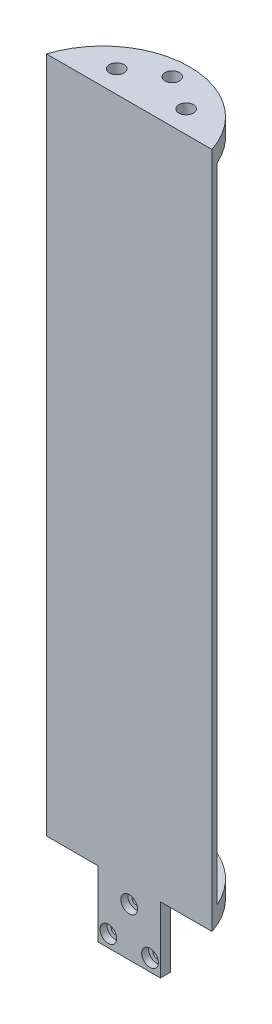
from build123d import *

# Parameters (mm, degrees)
BOSS_EXTRUDE1_DEPTH   = 123.825
SKETCH2_W             = 22.86
SKETCH2_H             = 3.683
BOSS_EXTRUDE2_DEPTH   = 24.13
SKETCH8_R             = 2.667
CUT_EXTRUDE3_DEPTH    = 5.08
SKETCH3_R             = 3.048
CUT_EXTRUDE1_DEPTH    = 2.54
F_3_0MM_DOWEL_HOLE1_D = 3
SKETCH6_W             = 60.494674014
SKETCH6_H             = 234.95
CUT_EXTRUDE2_DEPTH    = 19.05
SKETCH7_W             = 6.35
SKETCH7_H             = 18.890851128
BOSS_EXTRUDE3_DEPTH   = 234.95
FILLET1_R             = 2.54


with BuildPart() as part:
    # Sketch1 → Boss-Extrude1 (new, symmetric)
    with BuildSketch(Plane(origin=(0, 0, 0), x_dir=(1, 0, 0), z_dir=(0, 1, 0))):
        with BuildLine():
            ThreePointArc((30.247337007, 9.652), (0, 31.75), (-30.247337007, 9.652))
            Line((-30.247337007, 9.652), (30.247337007, 9.652))
        make_face()
    extrude(amount=BOSS_EXTRUDE1_DEPTH, both=True)

    # Sketch2 → Boss-Extrude2 (add)
    with BuildSketch(Plane.XZ.offset(123.825)):
        with Locations((0, -11.4935)):
            Rectangle(SKETCH2_W, SKETCH2_H)
    extrude(amount=BOSS_EXTRUDE2_DEPTH)

    # Sketch8 → Cut-Extrude3 (cut)
    with BuildSketch(Plane(origin=(0, 123.825, 0), x_dir=(1, 0, 0), z_dir=(0, 1, 0))):
        with Locations(Location((0, 25.4, 0), (0, 0, 270))):
            Circle(SKETCH8_R)
        with Locations(Location((-12.7, 17.78, 0), (0, 0, 270))):
            Circle(SKETCH8_R)
        with Locations(Location((12.7, 17.78, 0), (0, 0, 270))):
            Circle(SKETCH8_R)
    extrude(amount=-CUT_EXTRUDE3_DEPTH, mode=Mode.SUBTRACT)

    # Sketch3 → Cut-Extrude1 (cut)
    with BuildSketch(Plane.XY.offset(-9.652)):
        with Locations((0, -130.316247378)):
            Circle(SKETCH3_R)
        with Locations((-7.62, -143.514474532)):
            Circle(SKETCH3_R)
        with Locations((7.62, -143.514474532)):
            Circle(SKETCH3_R)
    extrude(amount=-CUT_EXTRUDE1_DEPTH, mode=Mode.SUBTRACT)

    # Ø3.0mm Dowel Hole1 (through all)
    with Locations(Plane.XY.offset(-9.652)):
        with Locations((0, -130.316247378), (7.62, -143.514474532), (-7.62, -143.514474532)):
            Hole(F_3_0MM_DOWEL_HOLE1_D / 2)

    # Sketch6 → Cut-Extrude2 (cut)
    with BuildSketch(Plane(origin=(0, 0, -31.75), x_dir=(-1, 0, 0), z_dir=(0, 0, -1))):
        Rectangle(SKETCH6_W, SKETCH6_H)
    extrude(amount=-CUT_EXTRUDE2_DEPTH, mode=Mode.SUBTRACT)

    # Sketch7 → Boss-Extrude3 (add)
    with BuildSketch(Plane.XZ.offset(-117.475)):
        with BuildLine():
            ThreePointArc((-3.175, -31.590851128), (0, -31.75), (3.175, -31.590851128))
            Line((3.175, -31.590851128), (-3.175, -31.590851128))
        make_face()
        with Locations((0, -22.145425564)):
            Rectangle(SKETCH7_W, SKETCH7_H)
    extrude(amount=BOSS_EXTRUDE3_DEPTH)

    # Fillet1
    # the kernel refuses this fillet: 2.54 mm, written as the material it adds along each edge
    with BuildSketch(Plane(origin=(3.175, 117.475, -37.940851128), x_dir=(1, 0, 0), z_dir=(0, 0, 1))) as fillet1_piece_1_section:
        with BuildLine():
            CenterArc((FILLET1_R, -FILLET1_R), FILLET1_R, 90, 90)
            Line((0, -FILLET1_R), (0, 0))
            Line((0, 0), (FILLET1_R, 0))
        make_face()
    fillet1_piece_1 = extrude(amount=25.240851128, mode=Mode.PRIVATE)
    fillet1_piece_1 = fillet1_piece_1 & Plane(origin=(0, 116.898787332, 0), x_dir=(0.9526720317087093, 0, -0.3040000000000001), z_dir=(0, 1, 0)) * Cylinder(31.75, 61, mode=Mode.PRIVATE)
    add(fillet1_piece_1)
    with BuildSketch(Plane(origin=(3.175, -117.475, -37.940851128), x_dir=(1, 0, 0), z_dir=(0, 0, 1))) as fillet1_piece_2_section:
        with BuildLine():
            CenterArc((FILLET1_R, FILLET1_R), FILLET1_R, 180, 90)
            Line((0, FILLET1_R), (0, 0))
            Line((0, 0), (FILLET1_R, 0))
        make_face()
    fillet1_piece_2 = extrude(amount=25.240851128, mode=Mode.PRIVATE)
    fillet1_piece_2 = fillet1_piece_2 & Plane(origin=(0, -116.898787332, 0), x_dir=(0.9526720317087093, 0, -0.3040000000000001), z_dir=(0, 1, 0)) * Cylinder(31.75, 61, mode=Mode.PRIVATE)
    add(fillet1_piece_2)
    with BuildSketch(Plane(origin=(-3.175, 117.475, -12.7), x_dir=(-1, 0, 0), z_dir=(0, 0, -1))) as fillet1_piece_3_section:
        with BuildLine():
            CenterArc((FILLET1_R, -FILLET1_R), FILLET1_R, 90, 90)
            Line((0, -FILLET1_R), (0, 0))
            Line((0, 0), (FILLET1_R, 0))
        make_face()
    fillet1_piece_3 = extrude(amount=25.240851128, mode=Mode.PRIVATE)
    fillet1_piece_3 = fillet1_piece_3 & Plane(origin=(0, 116.898782869, 0), x_dir=(0.9526720317087093, 0, -0.3040000000000001), z_dir=(0, 1, 0)) * Cylinder(31.75, 61, mode=Mode.PRIVATE)
    add(fillet1_piece_3)
    with BuildSketch(Plane(origin=(-3.175, -117.475, -12.7), x_dir=(-1, 0, 0), z_dir=(0, 0, -1))) as fillet1_piece_4_section:
        with BuildLine():
            CenterArc((FILLET1_R, FILLET1_R), FILLET1_R, 180, 90)
            Line((0, FILLET1_R), (0, 0))
            Line((0, 0), (FILLET1_R, 0))
        make_face()
    fillet1_piece_4 = extrude(amount=25.240851128, mode=Mode.PRIVATE)
    fillet1_piece_4 = fillet1_piece_4 & Plane(origin=(0, -116.898782869, 0), x_dir=(0.9526720317087093, 0, -0.3040000000000001), z_dir=(0, 1, 0)) * Cylinder(31.75, 61, mode=Mode.PRIVATE)
    add(fillet1_piece_4)
    with BuildSketch(Plane(origin=(-3.175, 123.825, -12.7), x_dir=(-1, 0, 0), z_dir=(0, -1, 0))) as fillet1_piece_5:
        with BuildLine():
            CenterArc((FILLET1_R, FILLET1_R), FILLET1_R, 180, 90)
            Line((0, FILLET1_R), (0, 0))
            Line((0, 0), (FILLET1_R, 0))
        make_face()
    extrude(amount=247.65)
    with BuildSketch(Plane(origin=(3.175, 123.825, -12.7), x_dir=(1, 0, 0), z_dir=(0, -1, 0))) as fillet1_piece_6:
        with BuildLine():
            CenterArc((FILLET1_R, -FILLET1_R), FILLET1_R, 90, 90)
            Line((0, -FILLET1_R), (0, 0))
            Line((0, 0), (FILLET1_R, 0))
        make_face()
    extrude(amount=247.65)


solid = part.part
